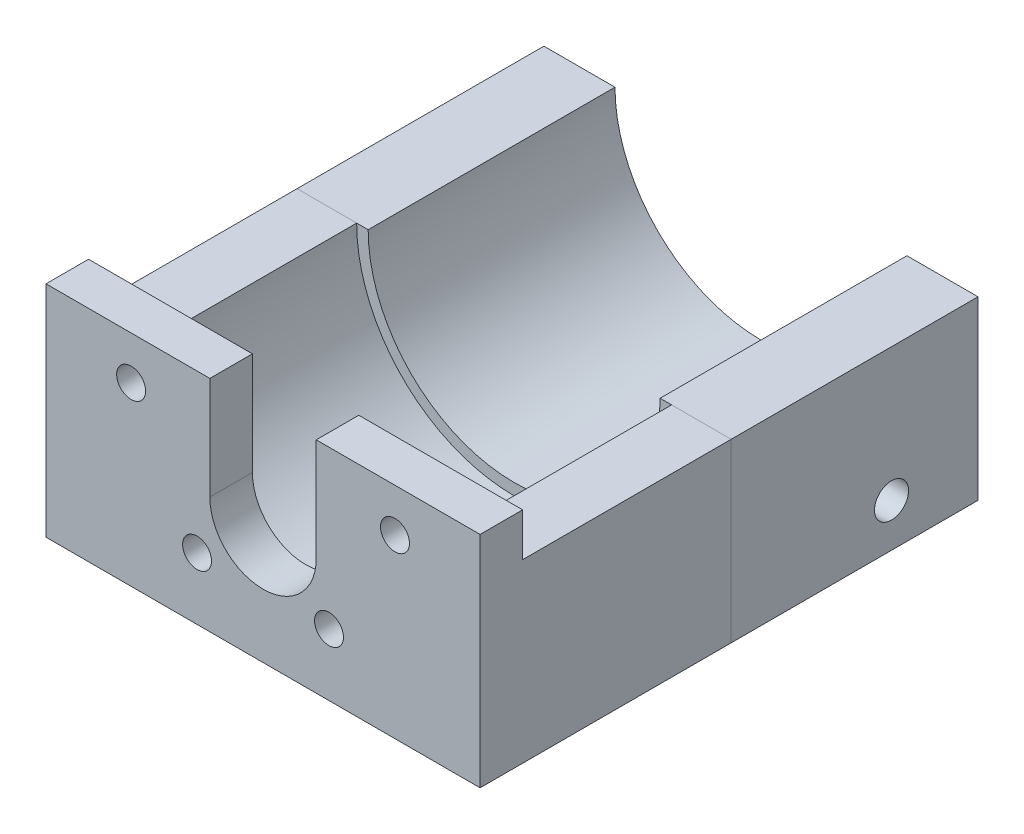
from build123d import *

# Parameters (mm, degrees)
BOSS_EXTRUDE1_DEPTH = 24.500000006
SKETCH2_R           = 1.7
BOSS_EXTRUDE2_DEPTH = 5
BOSS_EXTRUDE3_DEPTH = 29
SKETCH4_R           = 2.000000064
CUT_EXTRUDE1_DEPTH  = 6.99999997
SKETCH5_R           = 2.000000064
CUT_EXTRUDE2_DEPTH  = 6.99999997
SKETCH6_R           = 2.000000064
CUT_EXTRUDE3_DEPTH  = 6.99999997


with BuildPart() as part:
    # Sketch1 → Boss-Extrude1 (new body)
    with BuildSketch(Plane.XY):
        with BuildLine():
            Line((18.5, 0), (25.5, 0))
            Line((25.5, 0), (25.5, -20.716))
            Line((25.5, -20.716), (-25.5, -20.716))
            Line((-25.5, -20.716), (-25.5, 0))
            Line((-25.5, 0), (-18.5, 0))
            ThreePointArc((-18.5, 0), (0, -18.5), (18.5, 0))
        make_face()
    extrude(amount=BOSS_EXTRUDE1_DEPTH)

    # Sketch2 → Boss-Extrude2 (add)
    with BuildSketch(Plane.XY.offset(24.500000006)):
        with BuildLine():
            Line((-25.5, -20.716), (25.5, -20.716))
            Line((25.5, -20.716), (25.5, 5.071006361))
            Line((25.5, 5.071006361), (6.25, 5.071006361))
            Line((6.25, 5.071006361), (6.25, -7))
            ThreePointArc((6.25, -7), (0, -13.25), (-6.25, -7))
            Line((-6.25, -7), (-6.25, 5.071006361))
            Line((-6.25, 5.071006361), (-25.5, 5.071006361))
            Line((-25.5, 5.071006361), (-25.5, -20.716))
        make_face()
        with Locations((15.5, 0)):
            Circle(SKETCH2_R, mode=Mode.SUBTRACT)
        with Locations((-7.75, -13.423393759)):
            Circle(SKETCH2_R, mode=Mode.SUBTRACT)
        with Locations((-15.5, 0)):
            Circle(SKETCH2_R, mode=Mode.SUBTRACT)
        with Locations((7.75, -13.423393759)):
            Circle(SKETCH2_R, mode=Mode.SUBTRACT)
    extrude(amount=BOSS_EXTRUDE2_DEPTH)


with BuildPart() as body_2:
    # Sketch3 → Boss-Extrude3 (new body)
    with BuildSketch(Plane(origin=(0, 0, 0), x_dir=(-1, 0, 0), z_dir=(0, 0, -1))):
        with BuildLine():
            Line((17.15, 0), (25.5, 0))
            Line((25.5, 0), (25.5, -20.716))
            Line((25.5, -20.716), (-25.5, -20.716))
            Line((-25.5, -20.716), (-25.5, 0))
            Line((-25.5, 0), (-17.15, 0))
            ThreePointArc((-17.15, 0), (0, -17.15), (17.15, 0))
        make_face()
    extrude(amount=BOSS_EXTRUDE3_DEPTH)


with BuildPart() as cut_extrude1_tool:
    # Sketch4 → Cut-Extrude1 (new body)
    with BuildSketch(Plane.XZ.offset(20.716)):
        with Locations((-21.69, 25.690000006)):
            Circle(SKETCH4_R)
        with Locations((21.69, 25.690000006)):
            Circle(SKETCH4_R)
        with Locations((-21.69, -25.19)):
            Circle(SKETCH4_R)
        with Locations((21.69, -25.19)):
            Circle(SKETCH4_R)
    extrude(amount=-CUT_EXTRUDE1_DEPTH)


with BuildPart() as part_1:
    add(part.part)

    # Cut-Extrude1: cut by cut_extrude1_tool
    add(cut_extrude1_tool.part, mode=Mode.SUBTRACT)


with BuildPart() as body_2_1:
    add(body_2.part)

    # Cut-Extrude1: cut by cut_extrude1_tool
    add(cut_extrude1_tool.part, mode=Mode.SUBTRACT)

    # Sketch5 → Cut-Extrude2 (cut)
    with BuildSketch(Plane.ZY.offset(25.5)):
        with Locations((-18.84, -15.636)):
            Circle(SKETCH5_R)
    extrude(amount=-CUT_EXTRUDE2_DEPTH, mode=Mode.SUBTRACT)

    # Sketch6 → Cut-Extrude3 (cut)
    with BuildSketch(Plane(origin=(25.5, 0, 0), x_dir=(0, 0, -1), z_dir=(1, 0, 0))):
        with Locations((18.84, -15.636)):
            Circle(SKETCH6_R)
    extrude(amount=-CUT_EXTRUDE3_DEPTH, mode=Mode.SUBTRACT)


solid = Compound([part_1.part, body_2_1.part])
